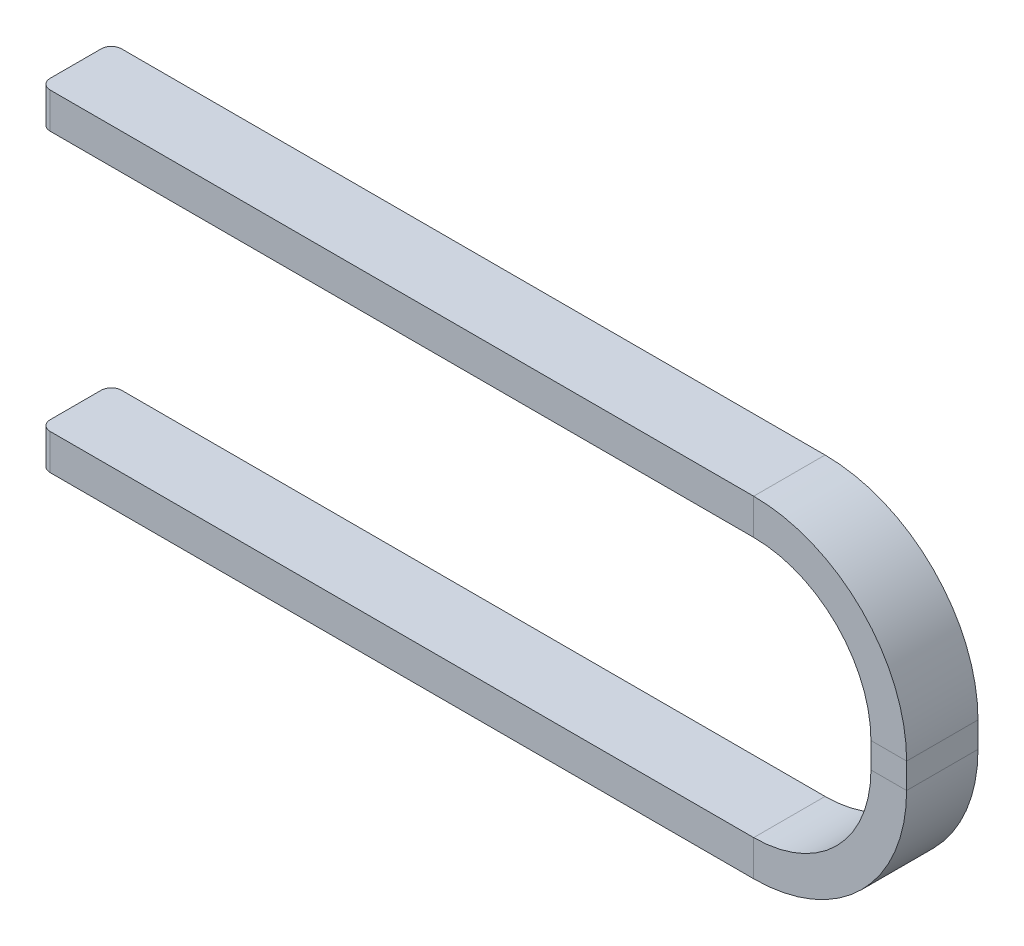
from build123d import *

# Parameters (mm, degrees)
SM_BASE_FLANGE_1_DEPTH = 1.4
FILLET_1_R             = 0.2


# Sheet-metal steps are written as plain solids
with BuildPart() as part:
    # Sketch 1 → Базовая кромка1 (new body)
    with BuildSketch(Plane.XY):
        with BuildLine():
            Line((0, 0), (14, 0))
            ThreePointArc((14, 0), (16.121320344, -0.878679656), (17, -3))
            Line((17, -3), (17, -3.5))
            ThreePointArc((17, -3.5), (16.121320344, -5.621320344), (14, -6.5))
            Line((14, -6.5), (0, -6.5))
            Line((0, -6.5), (0, -5.8))
            Line((0, -5.8), (14, -5.8))
            ThreePointArc((14, -5.8), (15.626345597, -5.126345597), (16.3, -3.5))
            Line((16.3, -3.5), (16.3, -3))
            ThreePointArc((16.3, -3), (15.626345597, -1.373654403), (14, -0.7))
            Line((14, -0.7), (0, -0.7))
            Line((0, -0.7), (0, 0))
        make_face()
    extrude(amount=SM_BASE_FLANGE_1_DEPTH)

    # Скругление1
    fillet_1_edges = [part.edges().sort_by_distance(p)[0] for p in [
        (0, -0.35, 0),
        (0, -6.15, 0),
        (0, -0.35, 1.4),
        (0, -6.15, 1.4),
    ]]
    fillet(fillet_1_edges, radius=FILLET_1_R)


solid = part.part
